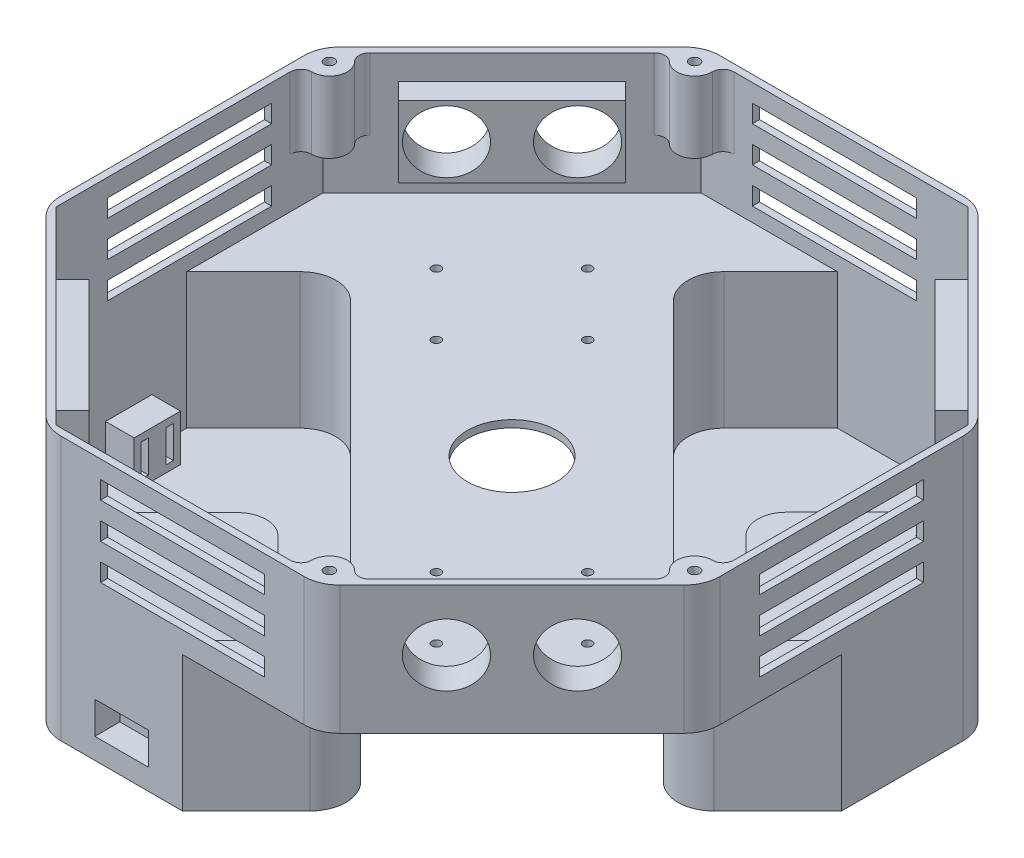
from build123d import *
from build123d.topology import SkipClean

# Parameters (mm, degrees)
BOSS_EXTRUDE1_DEPTH         = 74
CUT_EXTRUDE1_DEPTH          = 38
CUT_EXTRUDE3_DEPTH          = 8
CUT_EXTRUDE4_DEPTH          = 8.1
CUT_EXTRUDE5_DEPTH          = 38
SHELL2_START                = 40
SHELL2_DEPTH                = 34
SHELL2_START_2              = 10.1
SHELL2_2_DEPTH              = 29.9
SHELL2_START_3              = 2
SHELL2_3_DEPTH              = 8.1
SHELL2_START_4              = 10
SHELL2_4_DEPTH              = 0.1
SKETCH11_W                  = 45
SKETCH11_H                  = 20
BOSS_EXTRUDE2_DEPTH         = 6.5
SKETCH12_R                  = 8.75
CUT_EXTRUDE6_DEPTH          = 227.94764836
MIRROR2_COPY_1_SKETCH_W     = 45
MIRROR2_COPY_1_SKETCH_H     = 20
MIRROR2_COPY_1_DEPTH        = 6.5
MIRROR2_COPY_2_SKETCH_R     = 8.75
MIRROR2_COPY_2_DEPTH        = 227.94764836
SKETCH13_R                  = 5
BOSS_EXTRUDE3_DEPTH         = 20
FILLET2_R                   = 3
M3_5X0_6_TAPPED_HOLE1_D     = 2.9
M3_5X0_6_TAPPED_HOLE1_DEPTH = 10
M3_5X0_6_TAPPED_HOLE1_TIP   = 0.871247898
FILLET5_R                   = 10
BOSS_EXTRUDE4_DEPTH         = 8
CUT_EXTRUDE7_DEPTH          = 5
CUT_EXTRUDE8_DEPTH          = 148.75678601
SKETCH20_R                  = 10.5
BOSS_EXTRUDE5_DEPTH         = 6
SKETCH21_R                  = 8.5
CUT_EXTRUDE9_DEPTH          = 3
SKETCH22_R                  = 5.5
CUT_EXTRUDE10_DEPTH         = 3
CUT_EXTRUDE11_DEPTH         = 0.5
SKETCH24_R                  = 5.25
BOSS_EXTRUDE6_DEPTH         = 11
SKETCH25_R                  = 3.25
CUT_EXTRUDE12_DEPTH         = 8
CUT_EXTRUDE13_DEPTH         = 6
M3X0_5_TAPPED_HOLE1_D       = 2.5
M3X0_5_TAPPED_HOLE1_DEPTH   = 2.1
M3X0_5_TAPPED_HOLE1_TIP     = 0.751075774
M3X0_5_TAPPED_HOLE2_D       = 2.5
SKETCH34_R                  = 12.5
CUT_EXTRUDE14_DEPTH         = 137.070084191
CUT_EXTRUDE15_REACH         = 221.439
SKETCH35_W                  = 46
SKETCH35_H                  = 5
MIRROR4_COPY_1_REACH        = 221.439
MIRROR4_COPY_1_SKETCH_W     = 46
MIRROR4_COPY_1_SKETCH_H     = 5
SKETCH37_W                  = 19
SKETCH37_H                  = 13
BOSS_EXTRUDE7_DEPTH         = 9
SKETCH38_W                  = 15
SKETCH38_H                  = 9
CUT_EXTRUDE16_DEPTH         = 7
CUT_EXTRUDE17_REACH         = 215.579
SKETCH39_W                  = 15
SKETCH39_H                  = 3
SKETCH40_W                  = 13
SKETCH40_H                  = 13
BOSS_EXTRUDE8_DEPTH         = 10
SKETCH41_W                  = 9
SKETCH41_H                  = 9
CUT_EXTRUDE18_DEPTH         = 7
CUT_EXTRUDE19_REACH         = 215.579
SKETCH42_W                  = 2
SKETCH42_H                  = 9
FILLET6_R                   = 10


# Read off the part's stored shape, not the designer's step: Shell2
with BuildPart() as part:
    # Sketch1 → Boss-Extrude1 (new body)
    with BuildSketch(Plane(origin=(0, 0, 0), x_dir=(1, 0, 0), z_dir=(0, 1, 0))):
        Polygon((92.387953251, -38.268343237), (92.387953251, 38.268343237), (38.268343237, 92.387953251), (-38.268343237, 92.387953251), (-92.387953251, 38.268343237), (-92.387953251, -38.268343237), (-38.268343237, -92.387953251), (38.268343237, -92.387953251), align=None)
    extrude(amount=BOSS_EXTRUDE1_DEPTH)

    # Sketch3 → Cut-Extrude1 (cut)
    with BuildSketch(Plane.XZ):
        Polygon((-86.541351679, -44.114944808), (44.114944808, 86.541351679), (86.541351679, 44.114944808), (-44.114944808, -86.541351679), align=None)
    extrude(amount=-CUT_EXTRUDE1_DEPTH, mode=Mode.SUBTRACT)

    # Sketch5 → Cut-Extrude3 (cut)
    with BuildSketch(Plane.XZ):
        with BuildLine():
            Line((-23.608848154, 44.822051589), (-44.822051589, 23.608848154))
            ThreePointArc((-44.822051589, 23.608848154), (-49.064692277, 21.851488841), (-53.307332964, 23.608848154))
            Line((-53.307332964, 23.608848154), (-74.520536399, 44.822051589))
            ThreePointArc((-74.520536399, 44.822051589), (-76.277895712, 49.064692277), (-74.520536399, 53.307332964))
            Line((-74.520536399, 53.307332964), (-53.307332964, 74.520536399))
            ThreePointArc((-53.307332964, 74.520536399), (-49.064692277, 76.277895712), (-44.822051589, 74.520536399))
            Line((-44.822051589, 74.520536399), (-23.608848154, 53.307332964))
            ThreePointArc((-23.608848154, 53.307332964), (-21.851488841, 49.064692277), (-23.608848154, 44.822051589))
        make_face()
    extrude(amount=-CUT_EXTRUDE3_DEPTH, mode=Mode.SUBTRACT)

    # Sketch8 → Cut-Extrude4 (cut)
    with BuildSketch(Plane.XZ):
        with BuildLine():
            Line((53.307332964, -74.520536399), (74.520536399, -53.307332964))
            ThreePointArc((74.520536399, -53.307332964), (76.277895712, -49.064692277), (74.520536399, -44.822051589))
            Line((74.520536399, -44.822051589), (53.307332964, -23.608848154))
            ThreePointArc((53.307332964, -23.608848154), (49.064692277, -21.851488841), (44.822051589, -23.608848154))
            Line((44.822051589, -23.608848154), (23.608848154, -44.822051589))
            ThreePointArc((23.608848154, -44.822051589), (21.851488841, -49.064692277), (23.608848154, -53.307332964))
            Line((23.608848154, -53.307332964), (44.822051589, -74.520536399))
            ThreePointArc((44.822051589, -74.520536399), (49.064692277, -76.277895712), (53.307332964, -74.520536399))
        make_face()
    extrude(amount=-CUT_EXTRUDE4_DEPTH, mode=Mode.SUBTRACT)

    # Sketch9 → Cut-Extrude5 (cut)
    with BuildSketch(Plane.XZ):
        Polygon((0, 92.387953251), (92.387953251, 0), (117.986948508, 25.598995257), (39.264880132, 104.321063634), align=None)
        Polygon((0, -92.387953251), (-92.387953251, 0), (-117.986948508, -25.598995257), (-25.598995257, -117.986948508), align=None)
    extrude(amount=-CUT_EXTRUDE5_DEPTH, mode=Mode.SUBTRACT)

    # Shell2 outline → Shell2 (cut)
    with BuildSketch(Plane(origin=(0, 0, 0), x_dir=(1, 0, 0), z_dir=(0, 1, 0)).offset(SHELL2_START)):
        Polygon((-37.439916112, -90.387953251), (37.439916112, -90.387953251), (90.387953251, -37.439916112), (90.387953251, 37.439916112), (37.439916112, 90.387953251), (-37.439916112, 90.387953251), (-90.387953251, 37.439916112), (-90.387953251, -37.439916112), align=None)
    extrude(amount=SHELL2_DEPTH, mode=Mode.SUBTRACT)

    # Shell2 2 outline → Shell2 2 (cut)
    with BuildSketch(Plane(origin=(0, 0, 0), x_dir=(1, 0, 0), z_dir=(0, 1, 0)).offset(SHELL2_START_2)):
        Polygon((-37.439916112, -90.387953251), (-0.828427125, -90.387953251), (22.152346065, -67.407180061), (-67.407180061, 22.152346065), (-90.387953251, -0.828427125), (-90.387953251, -37.439916112), align=None)
        Polygon((67.407180061, -22.152346065), (90.387953251, 0.828427125), (90.387953251, 37.439916112), (37.439916112, 90.387953251), (0.828427125, 90.387953251), (-22.152346065, 67.407180061), align=None)
    extrude(amount=SHELL2_2_DEPTH, mode=Mode.SUBTRACT)

    # Shell2 3 outline → Shell2 3 (cut)
    with BuildSketch(Plane(origin=(0, 0, 0), x_dir=(1, 0, 0), z_dir=(0, 1, 0)).offset(SHELL2_START_3)):
        with BuildLine():
            Line((-49.565675577, -78.262193786), (-37.439916112, -90.387953251))
            Line((-37.439916112, -90.387953251), (-0.828427125, -90.387953251))
            Line((-0.828427125, -90.387953251), (22.152346065, -67.407180061))
            Line((22.152346065, -67.407180061), (-67.407180061, 22.152346065))
            Line((-67.407180061, 22.152346065), (-90.387953251, -0.828427125))
            Line((-90.387953251, -0.828427125), (-90.387953251, -37.439916112))
            Line((-90.387953251, -37.439916112), (-78.262193786, -49.565675577))
            ThreePointArc((-78.262193786, -49.565675577), (-77.761210486, -46.236265152), (-75.934749962, -43.407838027))
            Line((-75.934749962, -43.407838027), (-54.721546526, -22.194634591))
            ThreePointArc((-54.721546526, -22.194634591), (-49.064692276, -19.851488841), (-43.407838027, -22.194634591))
            Line((-43.407838027, -22.194634591), (-22.194634591, -43.407838027))
            ThreePointArc((-22.194634591, -43.407838027), (-19.851488841, -49.064692276), (-22.194634591, -54.721546526))
            Line((-22.194634591, -54.721546526), (-43.407838027, -75.934749962))
            ThreePointArc((-43.407838027, -75.934749962), (-46.236265152, -77.761210486), (-49.565675577, -78.262193786))
        make_face()
        with BuildLine():
            Line((67.407180061, -22.152346065), (90.387953251, 0.828427125))
            Line((90.387953251, 0.828427125), (90.387953251, 37.439916112))
            Line((90.387953251, 37.439916112), (78.262193786, 49.565675577))
            ThreePointArc((78.262193786, 49.565675577), (77.761210486, 46.236265152), (75.934749962, 43.407838027))
            Line((75.934749962, 43.407838027), (54.721546526, 22.194634591))
            ThreePointArc((54.721546526, 22.194634591), (49.064692276, 19.851488841), (43.407838027, 22.194634591))
            Line((43.407838027, 22.194634591), (22.194634591, 43.407838027))
            ThreePointArc((22.194634591, 43.407838027), (19.851488841, 49.064692276), (22.194634591, 54.721546526))
            Line((22.194634591, 54.721546526), (43.407838027, 75.934749962))
            ThreePointArc((43.407838027, 75.934749962), (46.236265152, 77.761210486), (49.565675577, 78.262193786))
            Line((49.565675577, 78.262193786), (37.439916112, 90.387953251))
            Line((37.439916112, 90.387953251), (0.828427125, 90.387953251))
            Line((0.828427125, 90.387953251), (-22.152346065, 67.407180061))
            Line((-22.152346065, 67.407180061), (67.407180061, -22.152346065))
        make_face()
    extrude(amount=SHELL2_3_DEPTH, mode=Mode.SUBTRACT)

    # Shell2 4 outline → Shell2 4 (cut)
    with BuildSketch(Plane(origin=(0, 0, 0), x_dir=(1, 0, 0), z_dir=(0, 1, 0)).offset(SHELL2_START_4)):
        with BuildLine():
            Line((-78.262193786, -49.565675577), (-49.565675577, -78.262193786))
            ThreePointArc((-49.565675577, -78.262193786), (-46.236265152, -77.761210486), (-43.407838027, -75.934749962))
            Line((-43.407838027, -75.934749962), (-22.194634591, -54.721546526))
            ThreePointArc((-22.194634591, -54.721546526), (-19.851488841, -49.064692276), (-22.194634591, -43.407838027))
            Line((-22.194634591, -43.407838027), (-43.407838027, -22.194634591))
            ThreePointArc((-43.407838027, -22.194634591), (-49.064692276, -19.851488841), (-54.721546526, -22.194634591))
            Line((-54.721546526, -22.194634591), (-75.934749962, -43.407838027))
            ThreePointArc((-75.934749962, -43.407838027), (-77.761210486, -46.236265152), (-78.262193786, -49.565675577))
        make_face()
    extrude(amount=SHELL2_4_DEPTH, mode=Mode.SUBTRACT)

    # Sketch11 → Boss-Extrude2 (add)
    with BuildSketch(Plane(origin=(63.913934681, 0, -63.913934681), x_dir=(0.707106781186552, 0, 0.707106781186543), z_dir=(-0.707106781186543, 0, 0.707106781186552))):
        with Locations((0, 57)):
            Rectangle(SKETCH11_W, SKETCH11_H)
    boss_extrude2 = extrude(amount=BOSS_EXTRUDE2_DEPTH)

    # Sketch12 → Cut-Extrude6 (cut, through all)
    with BuildSketch(Plane(origin=(59.317740604, 0, -59.317740604), x_dir=(0.7071067811865517, 0, 0.7071067811865434), z_dir=(-0.7071067811865434, 0, 0.7071067811865517))):
        with Locations((-13, 57)):
            Circle(SKETCH12_R)
        with Locations((13, 57)):
            Circle(SKETCH12_R)
    cut_extrude6 = extrude(amount=-CUT_EXTRUDE6_DEPTH, mode=Mode.SUBTRACT)

    # Mirror1: Boss-Extrude2, Cut-Extrude6 across plane
    add(boss_extrude2.mirror(Plane(origin=(0, 0, 0), x_dir=(0, 0, 1), z_dir=(1, 0, 0))))
    add(cut_extrude6.mirror(Plane(origin=(0, 0, 0), x_dir=(0, 0, 1), z_dir=(1, 0, 0))), mode=Mode.SUBTRACT)

    # Mirror2: Boss-Extrude2, Cut-Extrude6 across plane
    add(boss_extrude2.mirror(Plane.XY))
    add(cut_extrude6.mirror(Plane.XY), mode=Mode.SUBTRACT)

    # Mirror2 copy 1 sketch → Mirror2 copy 1 (add)
    with BuildSketch(Plane(origin=(-63.913934681, 0, 63.913934681), x_dir=(-0.707106781186552, 0, -0.707106781186543), z_dir=(0.707106781186543, 0, -0.707106781186552))):
        with Locations((0, 57)):
            Rectangle(MIRROR2_COPY_1_SKETCH_W, MIRROR2_COPY_1_SKETCH_H)
    extrude(amount=MIRROR2_COPY_1_DEPTH)

    # Mirror2 copy 2 sketch → Mirror2 copy 2 (cut, through all)
    with BuildSketch(Plane(origin=(-59.317740604, 0, 59.317740604), x_dir=(-0.7071067811865517, 0, -0.7071067811865434), z_dir=(0.7071067811865434, 0, -0.7071067811865517))):
        with Locations((-13, 57)):
            Circle(MIRROR2_COPY_2_SKETCH_R)
        with Locations((13, 57)):
            Circle(MIRROR2_COPY_2_SKETCH_R)
    extrude(amount=-MIRROR2_COPY_2_DEPTH, mode=Mode.SUBTRACT)

    # Sketch13 → Boss-Extrude3 (add)
    with BuildSketch(Plane(origin=(0, 74, 0), x_dir=(1, 0, 0), z_dir=(0, 1, 0))):
        with Locations((36.197275425, -87.387953251)):
            Circle(SKETCH13_R)
        with Locations((-87.387953251, 36.197275425)):
            Circle(SKETCH13_R)
        with Locations((-36.197275425, 87.387953251)):
            Circle(SKETCH13_R)
        with Locations((87.387953251, -36.197275425)):
            Circle(SKETCH13_R)
    extrude(amount=-BOSS_EXTRUDE3_DEPTH)

    # Fillet2
    fillet2_edges = [part.edges().sort_by_distance(p)[0] for p in [
        (-90.387953251, 64, -32.197275425),
        (-32.197275425, 64, -90.387953251),
        (90.387953251, 64, 32.197275425),
        (32.197275425, 64, 90.387953251),
        (41.147022893, 64, 86.68084647),
        (-86.68084647, 64, -41.147022893),
        (-41.147022893, 64, -86.68084647),
        (86.68084647, 64, 41.147022893),
    ]]
    fillet(fillet2_edges, radius=FILLET2_R)

    # M3.5x0.6 Tapped Hole1
    with Locations(Plane(origin=(0, 74, 0), x_dir=(1, 0, 0), z_dir=(0, 1, 0))):
        with Locations((-87.387953251, 36.197275425), (-36.197275425, 87.387953251), (36.197275425, -87.387953251), (87.387953251, -36.197275425)):
            Hole(M3_5X0_6_TAPPED_HOLE1_D / 2, depth=M3_5X0_6_TAPPED_HOLE1_DEPTH)
            with Locations((0, 0, -(M3_5X0_6_TAPPED_HOLE1_DEPTH + M3_5X0_6_TAPPED_HOLE1_TIP / 2))):  # 118° drill point
                Cone(0, M3_5X0_6_TAPPED_HOLE1_D / 2, M3_5X0_6_TAPPED_HOLE1_TIP, mode=Mode.SUBTRACT)

    # Fillet5
    fillet5_edges = [part.edges().sort_by_distance(p)[0] for p in [
        (-67.407180061, 19, -24.98077319),
        (-24.98077319, 19, -67.407180061),
        (24.98077319, 19, 67.407180061),
        (67.407180061, 19, 24.98077319),
        (-92.387953251, 37, 38.268343237),
        (-92.387953251, 56, -38.268343237),
        (-38.268343237, 56, -92.387953251),
        (38.268343237, 37, -92.387953251),
        (92.387953251, 37, -38.268343237),
        (92.387953251, 56, 38.268343237),
        (38.268343237, 56, 92.387953251),
        (-38.268343237, 37, 92.387953251),
    ]]
    fillet(fillet5_edges, radius=FILLET5_R)

    # Sketch17 → Boss-Extrude4 (add)
    with BuildSketch(Plane.XZ):
        Polygon((78.20181766, -41.140770328), (68.302322724, -31.241275392), (78.20181766, -21.341780455), (88.101312597, -31.241275392), align=None)
    extrude(amount=-BOSS_EXTRUDE4_DEPTH)

    # Sketch18 → Cut-Extrude7 (cut)
    with BuildSketch(Plane.XZ):
        Polygon((78.20181766, -22.755994018), (69.716536286, -31.241275392), (78.20181766, -39.726556766), (86.687099034, -31.241275392), align=None)
    extrude(amount=-CUT_EXTRUDE7_DEPTH, mode=Mode.SUBTRACT)

    # Sketch19 → Cut-Extrude8 (cut, through all)
    with BuildSketch(Plane.XZ.offset(-5)):
        Polygon((71.130749848, -32.655488954), (79.616031223, -24.17020758), (78.20181766, -22.755994018), (69.716536286, -31.241275392), align=None)
        Polygon((85.272885472, -29.82706183), (76.787604098, -38.312343204), (78.20181766, -39.726556766), (86.687099034, -31.241275392), align=None)
    extrude(amount=-CUT_EXTRUDE8_DEPTH, mode=Mode.SUBTRACT)

    # Sketch20 → Boss-Extrude5 (add)
    with BuildSketch(Plane(origin=(-65.328148244, 0, 65.328148244), x_dir=(0.7071067811865476, 0, 0.7071067811865476), z_dir=(-0.7071067811865476, 0, 0.7071067811865476))):
        with Locations((21.823296504, 23.5)):
            Circle(SKETCH20_R)
    extrude(amount=-BOSS_EXTRUDE5_DEPTH)

    # Sketch21 → Cut-Extrude9 (cut)
    with BuildSketch(Plane(origin=(-65.328148244, 0, 65.328148244), x_dir=(0.7071067811865476, 0, 0.7071067811865476), z_dir=(-0.7071067811865476, 0, 0.7071067811865476))):
        with Locations((21.823296504, 23.5)):
            Circle(SKETCH21_R)
    extrude(amount=-CUT_EXTRUDE9_DEPTH, mode=Mode.SUBTRACT)

    # Sketch22 → Cut-Extrude10 (cut)
    with BuildSketch(Plane(origin=(-63.2068279, 0, 63.2068279), x_dir=(0.7071067811865475, 0, 0.7071067811865477), z_dir=(-0.7071067811865477, 0, 0.7071067811865475))):
        with Locations((21.823296504, 23.5)):
            Circle(SKETCH22_R)
    extrude(amount=-CUT_EXTRUDE10_DEPTH, mode=Mode.SUBTRACT)

    # Sketch23 → Cut-Extrude11 (cut)
    with BuildSketch(Plane(origin=(65.328148244, 0, -65.328148244), x_dir=(-0.7071067811865475, 0, -0.7071067811865477), z_dir=(0.7071067811865477, 0, -0.7071067811865475))):
        with BuildLine():
            ThreePointArc((-21.75, 32.004587296), (-0.576436253, 5.280384017), (20.597127494, 32.004587296))
            ThreePointArc((20.597127494, 32.004587296), (-0.576436253, 23.013002699), (-21.75, 32.004587296))
        make_face()
    extrude(amount=-CUT_EXTRUDE11_DEPTH, mode=Mode.SUBTRACT)

    # Sketch24 → Boss-Extrude6 (add)
    with BuildSketch(Plane(origin=(-65.328148244, 0, 65.328148244), x_dir=(0.7071067811865476, 0, 0.7071067811865476), z_dir=(-0.7071067811865476, 0, 0.7071067811865476))):
        with Locations((-18.911326322, 18.5)):
            Circle(SKETCH24_R)
    extrude(amount=-BOSS_EXTRUDE6_DEPTH)

    # Sketch25 → Cut-Extrude12 (cut)
    with BuildSketch(Plane(origin=(-65.328148244, 0, 65.328148244), x_dir=(0.7071067811865476, 0, 0.7071067811865476), z_dir=(-0.7071067811865476, 0, 0.7071067811865476))):
        with Locations((-18.911326322, 18.5)):
            Circle(SKETCH25_R)
    extrude(amount=-CUT_EXTRUDE12_DEPTH, mode=Mode.SUBTRACT)

    # Sketch26 → Cut-Extrude13 (cut)
    with SkipClean():  # the faces are left unmerged after this step: merging them gives an invalid solid
        with BuildSketch(Plane(origin=(-59.671293994, 0, 59.671293994), x_dir=(0.7071067811865475, 0, 0.7071067811865477), z_dir=(-0.7071067811865477, 0, 0.7071067811865475))):
            with BuildLine():
                Line((-20.299863686, 21.438445846), (-20.299863686, 15.561554154))
                ThreePointArc((-20.299863686, 15.561554154), (-22.161326322, 18.5), (-20.299863686, 21.438445846))
            make_face()
            with BuildLine():
                Line((-17.522788959, 21.438445846), (-17.522788959, 15.561554154))
                ThreePointArc((-17.522788959, 15.561554154), (-15.661326322, 18.5), (-17.522788959, 21.438445846))
            make_face()
        extrude(amount=-CUT_EXTRUDE13_DEPTH, mode=Mode.SUBTRACT)

    # M3x0.5 Tapped Hole1
    with Locations(Plane.XZ.offset(-8)):
        with Locations((68.156575369, -46.943371933), (51.18601262, -29.972809184), (29.972809184, -51.18601262), (46.943371933, -68.156575369), (-51.18601262, 29.972809184), (-68.156575369, 46.943371933), (-29.972809184, 51.18601262), (-46.943371933, 68.156575369), (0, 0)):
            Hole(M3X0_5_TAPPED_HOLE1_D / 2, depth=M3X0_5_TAPPED_HOLE1_DEPTH)
            with Locations((0, 0, -(M3X0_5_TAPPED_HOLE1_DEPTH + M3X0_5_TAPPED_HOLE1_TIP / 2))):  # 118° drill point
                Cone(0, M3X0_5_TAPPED_HOLE1_D / 2, M3X0_5_TAPPED_HOLE1_TIP, mode=Mode.SUBTRACT)

    # M3x0.5 Tapped Hole2 (through all)
    with Locations(Plane.XZ.offset(-38)):
        with Locations((-56.135760088, -34.922556653), (-38.811643949, -17.598440514), (-17.598440514, -38.811643949), (-34.922556653, -56.135760088), (38.811643949, 17.598440514), (56.135760088, 34.922556653), (34.922556653, 56.135760088), (17.598440514, 38.811643949)):
            Hole(M3X0_5_TAPPED_HOLE2_D / 2)

    # Sketch34 → Cut-Extrude14 (cut, through all)
    with SkipClean():  # the faces are left unmerged after this step: merging them gives an invalid solid
        with BuildSketch(Plane.XZ.offset(-38)):
            with Locations(Location((0, 0, 0), (0, 0, 270))):
                Circle(SKETCH34_R)
        extrude(amount=-CUT_EXTRUDE14_DEPTH, mode=Mode.SUBTRACT)

    # Sketch35 → Cut-Extrude15 (cut, up to next)
    with BuildSketch(Plane(origin=(92.387953251, 0, 0), x_dir=(0, 0, -1), z_dir=(1, 0, 0)), mode=Mode.PRIVATE) as cut_extrude15_sk1:
        with Locations((0, 56.5)):
            Rectangle(SKETCH35_W, SKETCH35_H)
    cut_extrude15_tool1 = extrude(cut_extrude15_sk1.sketch, amount=-CUT_EXTRUDE15_REACH, mode=Mode.PRIVATE) & part.part
    # Sketch35 → Cut-Extrude15 (cut, up to next)
    with BuildSketch(Plane(origin=(92.387953251, 0, 0), x_dir=(0, 0, -1), z_dir=(1, 0, 0)), mode=Mode.PRIVATE) as cut_extrude15_sk2:
        with Locations((0, 66.5)):
            Rectangle(SKETCH35_W, SKETCH35_H)
    cut_extrude15_tool2 = extrude(cut_extrude15_sk2.sketch, amount=-CUT_EXTRUDE15_REACH, mode=Mode.PRIVATE) & part.part
    # Sketch35 → Cut-Extrude15 (cut, up to next)
    with BuildSketch(Plane(origin=(92.387953251, 0, 0), x_dir=(0, 0, -1), z_dir=(1, 0, 0)), mode=Mode.PRIVATE) as cut_extrude15_sk3:
        with Locations((0, 46.5)):
            Rectangle(SKETCH35_W, SKETCH35_H)
    cut_extrude15_tool3 = extrude(cut_extrude15_sk3.sketch, amount=-CUT_EXTRUDE15_REACH, mode=Mode.PRIVATE) & part.part
    cut_extrude15_1 = cut_extrude15_tool1.solids().sort_by_distance((92.387953, 56.5, 0))[0]
    add(cut_extrude15_1, mode=Mode.SUBTRACT)
    cut_extrude15_2 = cut_extrude15_tool2.solids().sort_by_distance((92.387953, 66.5, 0))[0]
    add(cut_extrude15_2, mode=Mode.SUBTRACT)
    cut_extrude15_3 = cut_extrude15_tool3.solids().sort_by_distance((92.387953, 46.5, 0))[0]
    add(cut_extrude15_3, mode=Mode.SUBTRACT)
    cut_extrude15 = cut_extrude15_1 + cut_extrude15_2 + cut_extrude15_3  # Cut-Extrude15 as one shape, for the pattern or mirror that repeats it

    # Mirror3: Cut-Extrude15 across plane
    with SkipClean():  # the faces are left unmerged after this step: merging them gives an invalid solid
        add(cut_extrude15.mirror(Plane(origin=(0, 0, 0), x_dir=(-0.7071067811865474, 0, 0.7071067811865478), z_dir=(0.7071067811865479, 0, 0.7071067811865472))), mode=Mode.SUBTRACT)

    # Mirror4: Cut-Extrude15 across plane
    with SkipClean():  # the faces are left unmerged after this step: merging them gives an invalid solid
        add(cut_extrude15.mirror(Plane(origin=(0, 0, 0), x_dir=(0.7071067811865478, 0, 0.7071067811865472), z_dir=(-0.7071067811865475, 0, 0.7071067811865477))), mode=Mode.SUBTRACT)

    # Mirror4 copy 1 sketch → Mirror4 copy 1 (cut, up to next)
    with BuildSketch(Plane.ZY.offset(92.387953251), mode=Mode.PRIVATE) as mirror4_copy_1_sk1:
        with Locations((0, 56.5)):
            Rectangle(MIRROR4_COPY_1_SKETCH_W, MIRROR4_COPY_1_SKETCH_H)
    mirror4_copy_1_tool1 = extrude(mirror4_copy_1_sk1.sketch, amount=-MIRROR4_COPY_1_REACH, mode=Mode.PRIVATE) & part.part
    # Mirror4 copy 1 sketch → Mirror4 copy 1 (cut, up to next)
    with BuildSketch(Plane.ZY.offset(92.387953251), mode=Mode.PRIVATE) as mirror4_copy_1_sk2:
        with Locations((0, 66.5)):
            Rectangle(MIRROR4_COPY_1_SKETCH_W, MIRROR4_COPY_1_SKETCH_H)
    mirror4_copy_1_tool2 = extrude(mirror4_copy_1_sk2.sketch, amount=-MIRROR4_COPY_1_REACH, mode=Mode.PRIVATE) & part.part
    # Mirror4 copy 1 sketch → Mirror4 copy 1 (cut, up to next)
    with BuildSketch(Plane.ZY.offset(92.387953251), mode=Mode.PRIVATE) as mirror4_copy_1_sk3:
        with Locations((0, 46.5)):
            Rectangle(MIRROR4_COPY_1_SKETCH_W, MIRROR4_COPY_1_SKETCH_H)
    mirror4_copy_1_tool3 = extrude(mirror4_copy_1_sk3.sketch, amount=-MIRROR4_COPY_1_REACH, mode=Mode.PRIVATE) & part.part
    add(mirror4_copy_1_tool1.solids().sort_by_distance((-92.387953, 56.5, 0))[0], mode=Mode.SUBTRACT)
    add(mirror4_copy_1_tool2.solids().sort_by_distance((-92.387953, 66.5, 0))[0], mode=Mode.SUBTRACT)
    add(mirror4_copy_1_tool3.solids().sort_by_distance((-92.387953, 46.5, 0))[0], mode=Mode.SUBTRACT)

    # Sketch37 → Boss-Extrude7 (add)
    with SkipClean():  # the faces are left unmerged after this step: merging them gives an invalid solid
        with BuildSketch(Plane.XY.offset(92.387953251)):
            with Locations((-17.063103806, 10.358155392)):
                Rectangle(SKETCH37_W, SKETCH37_H)
        extrude(amount=-BOSS_EXTRUDE7_DEPTH)

    # Sketch38 → Cut-Extrude16 (cut)
    with SkipClean():  # the faces are left unmerged after this step: merging them gives an invalid solid
        with BuildSketch(Plane.XY.offset(92.387953251)):
            with Locations((-17.063103806, 10.358155392)):
                Rectangle(SKETCH38_W, SKETCH38_H)
        extrude(amount=-CUT_EXTRUDE16_DEPTH, mode=Mode.SUBTRACT)

    # Sketch39 → Cut-Extrude17 (cut, up to next)
    with BuildSketch(Plane.XY.offset(85.387953251), mode=Mode.PRIVATE) as cut_extrude17_sk1:
        with Locations((-17.063103806, 10.358155392)):
            Rectangle(SKETCH39_W, SKETCH39_H)
    cut_extrude17_tool1 = extrude(cut_extrude17_sk1.sketch, amount=-CUT_EXTRUDE17_REACH, mode=Mode.PRIVATE) & part.part
    add(cut_extrude17_tool1.solids().sort_by_distance((-17.063104, 10.358155, 85.387953))[0], mode=Mode.SUBTRACT)

    # Sketch40 → Boss-Extrude8 (add)
    with SkipClean():  # the faces are left unmerged after this step: merging them gives an invalid solid
        with BuildSketch(Plane.ZY.offset(92.387953251)):
            with Locations((17.063103806, 8.5)):
                Rectangle(SKETCH40_W, SKETCH40_H)
        extrude(amount=-BOSS_EXTRUDE8_DEPTH)

    # Sketch41 → Cut-Extrude18 (cut)
    with SkipClean():  # the faces are left unmerged after this step: merging them gives an invalid solid
        with BuildSketch(Plane.ZY.offset(92.387953251)):
            with Locations((17.063103806, 8.5)):
                Rectangle(SKETCH41_W, SKETCH41_H)
        extrude(amount=-CUT_EXTRUDE18_DEPTH, mode=Mode.SUBTRACT)

    # Sketch42 → Cut-Extrude19 (cut, up to next)
    with BuildSketch(Plane.ZY.offset(85.387953251), mode=Mode.PRIVATE) as cut_extrude19_sk1:
        with Locations((13.563103806, 8.5)):
            Rectangle(SKETCH42_W, SKETCH42_H)
    cut_extrude19_tool1 = extrude(cut_extrude19_sk1.sketch, amount=-CUT_EXTRUDE19_REACH, mode=Mode.PRIVATE) & part.part
    # Sketch42 → Cut-Extrude19 (cut, up to next)
    with BuildSketch(Plane.ZY.offset(85.387953251), mode=Mode.PRIVATE) as cut_extrude19_sk2:
        with Locations((20.563103806, 8.5)):
            Rectangle(SKETCH42_W, SKETCH42_H)
    cut_extrude19_tool2 = extrude(cut_extrude19_sk2.sketch, amount=-CUT_EXTRUDE19_REACH, mode=Mode.PRIVATE) & part.part
    add(cut_extrude19_tool1.solids().sort_by_distance((-85.387953, 8.5, 13.563104))[0], mode=Mode.SUBTRACT)
    add(cut_extrude19_tool2.solids().sort_by_distance((-85.387953, 8.5, 20.563104))[0], mode=Mode.SUBTRACT)

    # Fillet6
    fillet6_edges = [part.edges().sort_by_distance(p)[0] for p in [
        (-67.407180061, 21, -22.152346065),
        (22.152346065, 21, 67.407180061),
        (-22.152346065, 21, -67.407180061),
        (67.407180061, 21, 22.152346065),
    ]]
    fillet(fillet6_edges, radius=FILLET6_R)


solid = part.part
